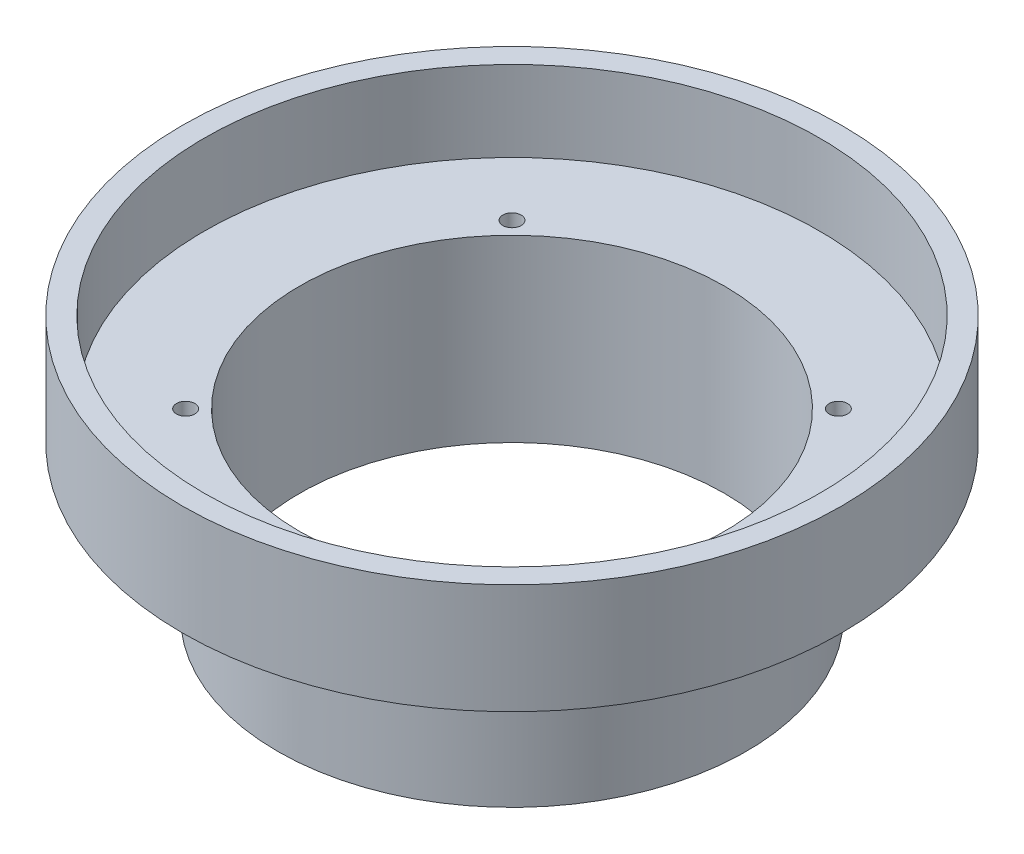
from build123d import *

# Parameters (mm, degrees)
SKETCH_1_R                 = 32
EXTRUDE_1_DEPTH            = 20.5
SKETCH_12_R                = 45
EXTRUDE_2_DEPTH            = 15
SKETCH_11_R                = 29
CUT_EXTRUDE_6_DEPTH        = 35.5
SKETCH_13_R                = 42
CUT_EXTRUDE_7_DEPTH        = 11
HOLE_START                 = 20.5
HOLE_WIZARD_M3_1_OUTLINE_R = 1.25
HOLE_WIZARD_M3_1_DEPTH     = 4


# Read off the part's stored shape, not the designer's step: M3 螺纹孔1
with BuildPart() as part:
    # 草图1 → 凸台-拉伸1 (new body)
    with BuildSketch(Plane(origin=(0, 0, 0), x_dir=(1, 0, 0), z_dir=(0, 1, 0))):
        with Locations(Location((0, 0, 0), (0, 0, 270))):
            Circle(SKETCH_1_R)
    extrude(amount=EXTRUDE_1_DEPTH)

    # 草图12 → 凸台-拉伸2 (add)
    with BuildSketch(Plane(origin=(0, 20.5, 0), x_dir=(1, 0, 0), z_dir=(0, 1, 0))):
        with Locations(Location((0, 0, 0), (0, 0, 270))):
            Circle(SKETCH_12_R)
    extrude(amount=EXTRUDE_2_DEPTH)

    # 草图11 → 切除-拉伸6 (cut)
    with BuildSketch(Plane(origin=(0, 0, 0), x_dir=(1, 0, 0), z_dir=(0, 1, 0))):
        with Locations(Location((0, 0, 0), (0, 0, 90))):
            Circle(SKETCH_11_R)
    extrude(amount=CUT_EXTRUDE_6_DEPTH, mode=Mode.SUBTRACT)

    # 草图13 → 切除-拉伸7 (cut)
    with BuildSketch(Plane(origin=(0, 35.5, 0), x_dir=(1, 0, 0), z_dir=(0, 1, 0))):
        with Locations(Location((0, 0, 0), (0, 0, 270))):
            Circle(SKETCH_13_R)
    extrude(amount=-CUT_EXTRUDE_7_DEPTH, mode=Mode.SUBTRACT)

    # M3 螺纹孔1 outline → M3 螺纹孔1 (cut)
    with BuildSketch(Plane(origin=(0, 0, 0), x_dir=(1, 0, 0), z_dir=(0, 1, 0)).offset(HOLE_START)):
        with Locations((-22.273863607, -22.273863607)):
            Circle(HOLE_WIZARD_M3_1_OUTLINE_R)
        with Locations((22.273863607, -22.273863607)):
            Circle(HOLE_WIZARD_M3_1_OUTLINE_R)
        with Locations((22.273863607, 22.273863607)):
            Circle(HOLE_WIZARD_M3_1_OUTLINE_R)
        with Locations((-22.273863607, 22.273863607)):
            Circle(HOLE_WIZARD_M3_1_OUTLINE_R)
    extrude(amount=HOLE_WIZARD_M3_1_DEPTH, mode=Mode.SUBTRACT)


solid = part.part
